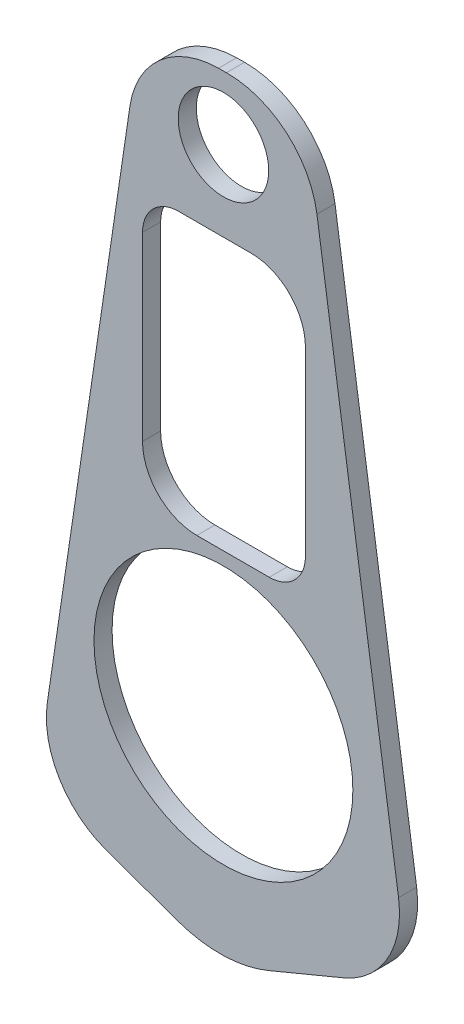
from build123d import *

# Parameters (mm, degrees)
SKETCH3_R           = 250
SKETCH3_R_2         = 715
BOSS_EXTRUDE2_DEPTH = 100


with BuildPart() as part:
    # Sketch3 → Boss-Extrude2 (new body)
    with BuildSketch(Plane.XY):
        with BuildLine():
            Line((826.002663135, 512.119520465), (1217.72739884, 371.909911632))
            ThreePointArc((1217.72739884, 371.909911632), (1471.313632018, 331.188596019), (1722.518239517, 384.671755745))
            Line((1722.518239517, 384.671755745), (2137.410265393, 557.291219765))
            ThreePointArc((2137.410265393, 557.291219765), (2380.551087481, 772.773197497), (2439.9466137, 1092.182204192))
            Line((2439.9466137, 1092.182204192), (1989.077138125, 4136.458817538))
            ThreePointArc((1989.077138125, 4136.458817538), (1819.071083369, 4443.515726757), (1489.120890911, 4563.177227038))
            Line((1489.120890911, 4563.177227038), (1445.287692771, 4562.708066647))
            ThreePointArc((1445.287692771, 4562.708066647), (1121.988448811, 4439.550700256), (956.03414441, 4135.989657147))
            Line((956.03414441, 4135.989657147), (499.894102065, 1056.12610783))
            ThreePointArc((499.894102065, 1056.12610783), (565.649838055, 725.796519774), (826.002663135, 512.119520465))
        make_face()
        with Locations((1472.590383528, 4210.952449016)):
            Circle(SKETCH3_R, mode=Mode.SUBTRACT)
        with Locations((1472.590383528, 1480.687080567)):
            Circle(SKETCH3_R_2, mode=Mode.SUBTRACT)
        with BuildLine():
            Line((1325.684470666, 2267.873532331), (1725.684470666, 2267.873532331))
            ThreePointArc((1725.684470666, 2267.873532331), (1867.105826903, 2326.452176093), (1925.684470666, 2467.873532331))
            Line((1925.684470666, 2467.873532331), (1925.684470666, 3467.873532331))
            ThreePointArc((1925.684470666, 3467.873532331), (1837.816505022, 3680.005566687), (1625.684470666, 3767.873532331))
            Line((1625.684470666, 3767.873532331), (1225.684470666, 3767.873532331))
            ThreePointArc((1225.684470666, 3767.873532331), (1084.263114428, 3709.294888568), (1025.684470666, 3567.873532331))
            Line((1025.684470666, 3567.873532331), (1025.684470666, 2567.873532331))
            ThreePointArc((1025.684470666, 2567.873532331), (1113.55243631, 2355.741497975), (1325.684470666, 2267.873532331))
        make_face(mode=Mode.SUBTRACT)
    extrude(amount=BOSS_EXTRUDE2_DEPTH)


solid = part.part
